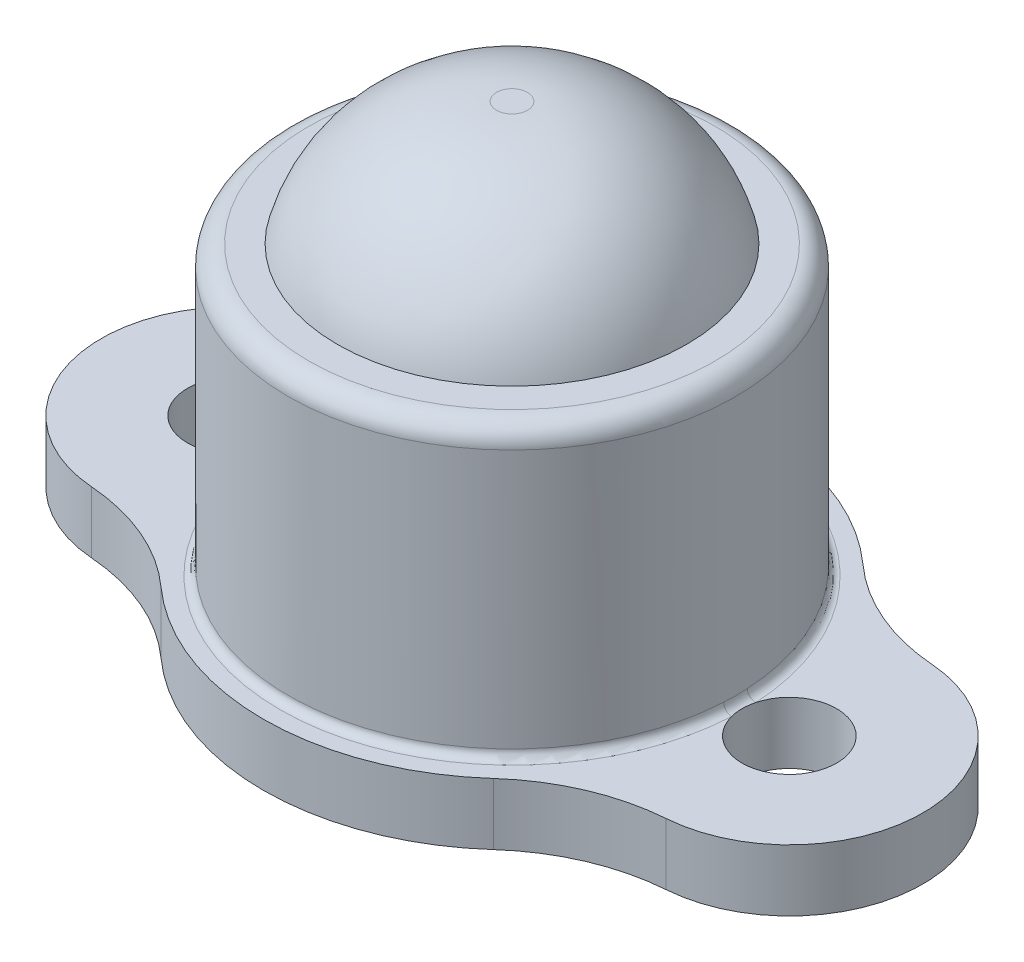
from build123d import *

# Parameters (mm, degrees)
SKETCH1_R           = 2.946896199
BOSS_EXTRUDE1_DEPTH = 1.5
SKETCH2_R           = 1.15
CUT_EXTRUDE1_DEPTH  = 1.5
SKETCH3_R           = 5.446896199
SKETCH3_R_2         = 2.946896199
BOSS_EXTRUDE2_DEPTH = 7
SKETCH4_R           = 4.25
BOSS_EXTRUDE3_DEPTH = 3
FILLET1_R           = 4
FILLET2_R           = 0.5
FILLET3_R           = 0.2


with BuildPart() as part:
    # Sketch1 → Boss-Extrude1 (new body)
    with BuildSketch(Plane(origin=(0, 0, 0), x_dir=(1, 0, 0), z_dir=(0, 1, 0))):
        with BuildLine():
            ThreePointArc((-4.043822449, -4.5), (0, -6.05), (4.043822449, -4.5))
            ThreePointArc((4.043822449, -4.5), (5.414156345, -3.625965374), (6.993227337, -3.240885753))
            ThreePointArc((6.993227337, -3.240885753), (10, 0), (6.993227337, 3.240885753))
            ThreePointArc((6.993227337, 3.240885753), (5.414156345, 3.625965374), (4.043822449, 4.5))
            ThreePointArc((4.043822449, 4.5), (0, 6.05), (-4.043822449, 4.5))
            ThreePointArc((-4.043822449, 4.5), (-5.414156345, 3.625965374), (-6.993227337, 3.240885753))
            ThreePointArc((-6.993227337, 3.240885753), (-10, 0), (-6.993227337, -3.240885753))
            ThreePointArc((-6.993227337, -3.240885753), (-5.414156345, -3.625965374), (-4.043822449, -4.5))
        make_face()
        with Locations(Location((0, 0, 0), (0, 0, 270))):
            Circle(SKETCH1_R, mode=Mode.SUBTRACT)
    extrude(amount=BOSS_EXTRUDE1_DEPTH)

    # Sketch2 → Cut-Extrude1 (cut)
    with BuildSketch(Plane(origin=(0, 1.5, 0), x_dir=(1, 0, 0), z_dir=(0, 1, 0))):
        with Locations(Location((-6.75, 0, 0), (0, 0, 270))):
            Circle(SKETCH2_R)
        with Locations(Location((6.75, 0, 0), (0, 0, 270))):
            Circle(SKETCH2_R)
    extrude(amount=-CUT_EXTRUDE1_DEPTH, mode=Mode.SUBTRACT)

    # Sketch3 → Boss-Extrude2 (add)
    with BuildSketch(Plane(origin=(0, 1.5, 0), x_dir=(1, 0, 0), z_dir=(0, 1, 0))):
        with Locations(Location((0, 0, 0), (0, 0, 270))):
            Circle(SKETCH3_R)
        with Locations(Location((0, 0, 0), (0, 0, 270))):
            Circle(SKETCH3_R_2, mode=Mode.SUBTRACT)
    extrude(amount=BOSS_EXTRUDE2_DEPTH)

    # Sketch4 → Boss-Extrude3 (add)
    with BuildSketch(Plane(origin=(0, 8.5, 0), x_dir=(1, 0, 0), z_dir=(0, 1, 0))):
        with Locations(Location((0, 0, 0), (0, 0, 270))):
            Circle(SKETCH4_R)
    extrude(amount=BOSS_EXTRUDE3_DEPTH)

    # Fillet1
    # the kernel refuses this fillet: 4 mm, written as the material it takes off along each edge
    with BuildSketch(Plane(origin=(0, 11.5, 0), x_dir=(0, 0, 1), z_dir=(-1, 0, 0))) as fillet1_piece_1:
        with BuildLine():
            CenterArc((0.377016654, -4), FILLET1_R, 14.477512186, 75.522487814)
            Line((0.377016654, 0), (0.377016654, 0.08))
            Line((0.377016654, 0.08), (4.25, 0.08))
            Line((4.25, 0.08), (4.33, 0))
            ThreePointArc((4.33, 0), (4.33, -1.5), (4.327459667, -2.98))
            Line((4.327459667, -2.98), (4.25, -3))
        make_face()
    revolve(axis=Axis((0, 11.5, 0), (0, 1, 0)), mode=Mode.SUBTRACT)

    # Fillet2
    fillet2_edges = [part.edges().sort_by_distance(p)[0] for p in [
        (0, 8.5, -5.446896199),
    ]]
    fillet(fillet2_edges, radius=FILLET2_R)

    # Fillet3
    fillet3_edges = [part.edges().sort_by_distance(p)[0] for p in [
        (0, 1.5, -5.446896199),
    ]]
    fillet(fillet3_edges, radius=FILLET3_R)


solid = part.part
